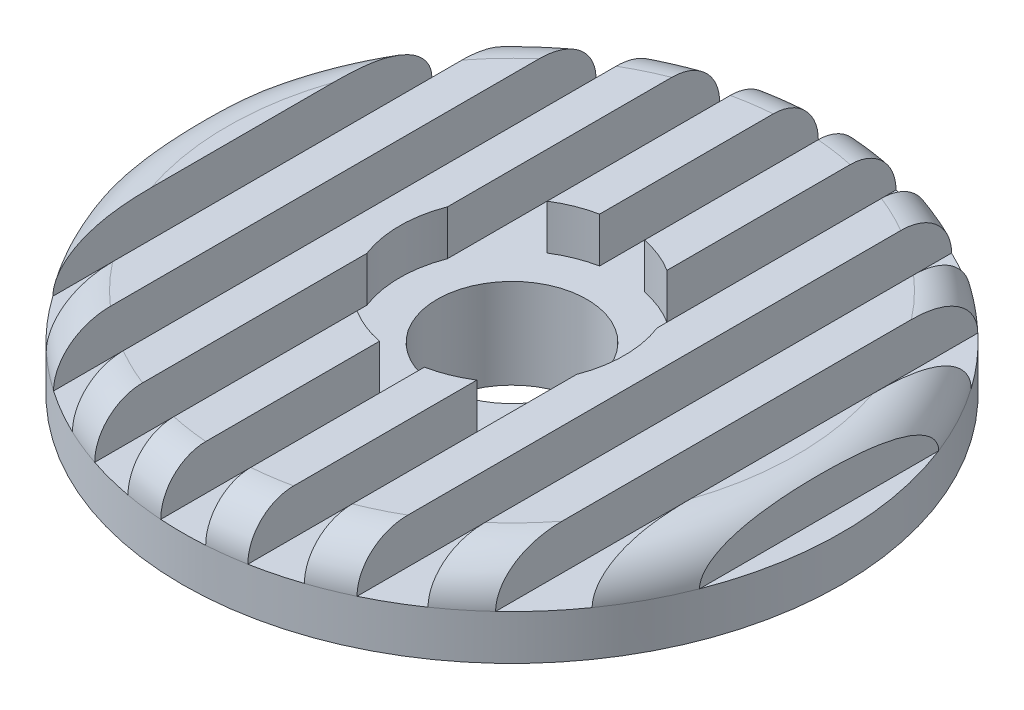
from build123d import *

# Parameters (mm, degrees)
SKETCH1_R           = 22
SKETCH1_R_2         = 10
SKETCH1_R_3         = 7.5
SKETCH1_R_4         = 5
BOSS_EXTRUDE2_DEPTH = 3
SKETCH1_5_R         = 7.5
CUT_EXTRUDE3_DEPTH  = 32.256999367
BOSS_EXTRUDE3_START = -6
SKETCH1_9_R         = 10
SKETCH1_9_R_2       = 5
BOSS_EXTRUDE3_DEPTH = 3
SKETCH2_W           = 3
SKETCH2_H           = 50
CUT_EXTRUDE4_DEPTH  = 32.685959174
LPATTERN1_COUNT     = 9
LPATTERN1_PITCH     = 5.5


with BuildPart() as part:
    # Sketch1 → Boss-Extrude2 (new, symmetric)
    # profile 1 of 3: a face of its own
    with BuildSketch(Plane(origin=(0, 0, 0), x_dir=(1, 0, 0), z_dir=(0, 1, 0))):
        with Locations(Location((0, 0, 0), (0, 0, 270))):
            Circle(SKETCH1_R)
        Circle(SKETCH1_R_2, mode=Mode.SUBTRACT)
    # profile 2 of 3: a face of its own
    with BuildSketch(Plane(origin=(0, 0, 0), x_dir=(1, 0, 0), z_dir=(0, 1, 0))):
        Circle(SKETCH1_R_2)
        Circle(SKETCH1_R_3, mode=Mode.SUBTRACT)
    # profile 3 of 3: a face of its own
    with BuildSketch(Plane(origin=(0, 0, 0), x_dir=(1, 0, 0), z_dir=(0, 1, 0))):
        Circle(SKETCH1_R_3)
        with Locations(Location((0, 0, 0), (0, 0, 270))):
            Circle(SKETCH1_R_4, mode=Mode.SUBTRACT)
    extrude(amount=BOSS_EXTRUDE2_DEPTH, both=True)

    # Fillet2: read off the stored shape, not the designer's step
    # Fillet2 outline → Fillet2 (revolve, cut)
    with BuildSketch(Plane.XY):
        with BuildLine():
            ThreePointArc((19, 3), (21.121320344, 2.121320344), (22, 0))
            Line((22, 0), (22, 3))
            Line((22, 3), (19, 3))
        make_face()
    revolve(axis=Axis((0, 0, 0), (0, 1, 0)), mode=Mode.SUBTRACT)

    # Sketch1<5> → Cut-Extrude3 (cut, through all)
    with BuildSketch(Plane(origin=(0, 0, 0), x_dir=(1, 0, 0), z_dir=(0, 1, 0))):
        with Locations(Location((0, 0, 0), (0, 0, 270))):
            Circle(SKETCH1_5_R)
    extrude(amount=CUT_EXTRUDE3_DEPTH, mode=Mode.SUBTRACT)

    # Sketch1<9> → Boss-Extrude3 (add)
    with BuildSketch(Plane(origin=(0, 0, 0), x_dir=(1, 0, 0), z_dir=(0, 1, 0)).offset(BOSS_EXTRUDE3_START)):
        with Locations(Location((0, 0, 0), (0, 0, 270))):
            Circle(SKETCH1_9_R)
        with Locations(Location((0, 0, 0), (0, 0, 270))):
            Circle(SKETCH1_9_R_2, mode=Mode.SUBTRACT)
    extrude(amount=BOSS_EXTRUDE3_DEPTH)

    # Sketch2 → Cut-Extrude4 (cut, through all)
    with BuildSketch(Plane(origin=(0, 0, 0), x_dir=(1, 0, 0), z_dir=(0, 1, 0))):
        with Locations((-22, 0)):
            Rectangle(SKETCH2_W, SKETCH2_H)
    cut_extrude4 = extrude(amount=CUT_EXTRUDE4_DEPTH, mode=Mode.SUBTRACT)

    # LPattern1: Cut-Extrude4 ×9
    with Locations(*[(i * LPATTERN1_PITCH, 0, 0) for i in range(1, LPATTERN1_COUNT)]):
        add(cut_extrude4, mode=Mode.SUBTRACT)


solid = part.part
